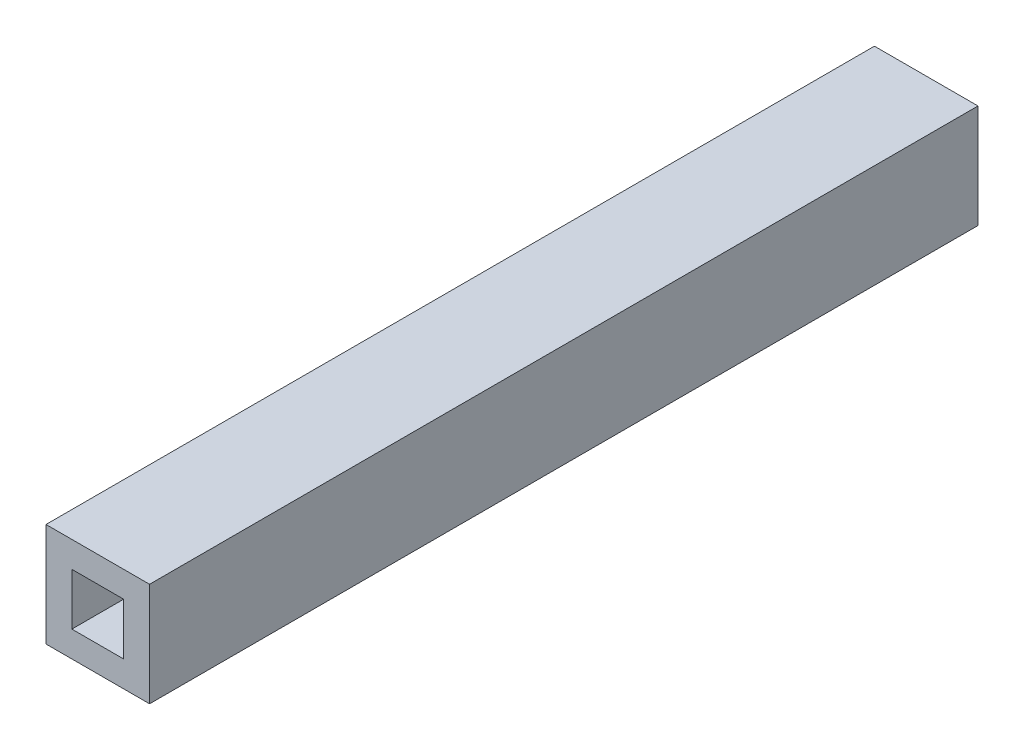
from build123d import *

# Parameters (mm, degrees)
SKETCH1_W           = 25.4
SKETCH1_H           = 25.4
BOSS_EXTRUDE1_DEPTH = 203.2
SKETCH2_W           = 12.7
SKETCH2_H           = 12.7
CUT_EXTRUDE1_DEPTH  = 207.350575478


with BuildPart() as part:
    # Sketch1 → Boss-Extrude1 (new body)
    with BuildSketch(Plane.XY):
        with Locations((12.7, 12.7)):
            Rectangle(SKETCH1_W, SKETCH1_H)
    extrude(amount=BOSS_EXTRUDE1_DEPTH)

    # Sketch2 → Cut-Extrude1 (cut, through all)
    with BuildSketch(Plane.XY.offset(203.2)):
        with Locations((12.7, 12.7)):
            Rectangle(SKETCH2_W, SKETCH2_H)
    extrude(amount=-CUT_EXTRUDE1_DEPTH, mode=Mode.SUBTRACT)


solid = part.part
